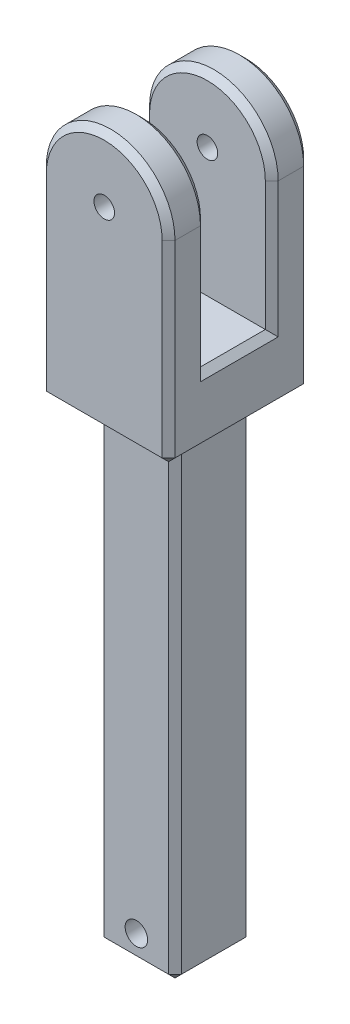
from build123d import *

# Parameters (mm, degrees)
EXTRUDE_1_DEPTH     = 12
CUT_EXTRUDE_1_DEPTH = 39.218600963
CUT_EXTRUDE_6_DEPTH = 39.218600963
SKETCH_12_R         = 1.6
EXTRUDE_11_DEPTH    = 5
EXTRUDE_START       = 5
SKETCH_13_R         = 1.6
EXTRUDE_12_DEPTH    = 5
SKETCH_14_W         = 10.08
SKETCH_14_H         = 30
CUT_EXTRUDE_7_DEPTH = 41.070705753
SKETCH_15_W         = 12
SKETCH_15_H         = 12
EXTRUDE_13_DEPTH    = 74
CUT_EXTRUDE_8_DEPTH = 107.125262104
CHAMFER_1_SIZE      = 1


with BuildPart() as part:
    # 草圖1 → 填料-伸長1 (new body)
    with BuildSketch(Plane.XY):
        with BuildLine():
            ThreePointArc((10, 0), (0, 10), (-10, 0))
            Line((-10, 0), (-10, -30.276417548))
            Line((-10, -30.276417548), (10, -30.276417548))
            Line((10, -30.276417548), (10, 0))
        make_face()
        with BuildLine():
            ThreePointArc((0, -1.6), (-1.13137085, 1.13137085), (1.6, 0))
            ThreePointArc((1.6, 0), (1.13137085, -1.13137085), (0, -1.6))
        make_face(mode=Mode.SUBTRACT)
    extrude(amount=EXTRUDE_1_DEPTH)

    # 草圖2 → 除料-伸長1 (cut, through all)
    with BuildSketch(Plane(origin=(10, 0, 0), x_dir=(0, 0, -1), z_dir=(1, 0, 0))):
        Polygon((-9, 15.780779257), (-9, 0), (-8.60053373, -20), (-3, -20), (-3, 15.780779257), align=None)
    extrude(amount=-CUT_EXTRUDE_1_DEPTH, mode=Mode.SUBTRACT)

    # 草圖11 → 除料-伸長6 (cut, through all)
    with BuildSketch(Plane(origin=(10, 0, 0), x_dir=(0, 0, -1), z_dir=(1, 0, 0))):
        Polygon((-9, 0), (-9, -20), (-8.60053373, -20), align=None)
    extrude(amount=-CUT_EXTRUDE_6_DEPTH, mode=Mode.SUBTRACT)

    # 草圖12 → 填料-伸長11 (add)
    with BuildSketch(Plane.XY.offset(12)):
        with BuildLine():
            Line((10, -30.276417548), (10, 0))
            ThreePointArc((10, 0), (0, 10), (-10, 0))
            Line((-10, 0), (-10, -30.276417548))
            Line((-10, -30.276417548), (10, -30.276417548))
        make_face()
        Circle(SKETCH_12_R, mode=Mode.SUBTRACT)
    extrude(amount=EXTRUDE_11_DEPTH)

    # 草圖13 → 填料-伸長12 (add)
    with BuildSketch(Plane(origin=(0, 0, 0), x_dir=(-1, 0, 0), z_dir=(0, 0, -1)).offset(EXTRUDE_START)):
        with BuildLine():
            Line((10, -30.276417548), (10, 0))
            ThreePointArc((10, 0), (0, 10), (-10, 0))
            Line((-10, 0), (-10, -30.276417548))
            Line((-10, -30.276417548), (10, -30.276417548))
        make_face()
        Circle(SKETCH_13_R, mode=Mode.SUBTRACT)
    extrude(amount=-EXTRUDE_12_DEPTH)

    # 草圖14 → 除料-伸長7 (cut, through all)
    with BuildSketch(Plane.ZY.offset(10)):
        with Locations((6, -5)):
            Rectangle(SKETCH_14_W, SKETCH_14_H)
    extrude(amount=-CUT_EXTRUDE_7_DEPTH, mode=Mode.SUBTRACT)

    # 草圖15 → 填料-伸長13 (add)
    with BuildSketch(Plane.XZ.offset(30.276417548)):
        with Locations((0, 6)):
            Rectangle(SKETCH_15_W, SKETCH_15_H)
    extrude(amount=EXTRUDE_13_DEPTH)

    # 草圖17 → 除料-伸長8 (cut, through all)
    with BuildSketch(Plane(origin=(0, 0, 0), x_dir=(-1, 0, 0), z_dir=(0, 0, -1))):
        with BuildLine():
            ThreePointArc((0, -102.026417548), (1.237436867, -101.513854415), (1.75, -100.276417548))
            ThreePointArc((1.75, -100.276417548), (-1.237436867, -99.038980681), (0, -102.026417548))
        make_face()
    extrude(amount=-CUT_EXTRUDE_8_DEPTH, mode=Mode.SUBTRACT)

    # 導角1
    chamfer_1_edges = [part.edges().sort_by_distance(p)[0] for p in [
        (-10, -10, 0.96),
        (-10, -10, 11.04),
        (-10, -20, 6),
        (0, 10, 0.96),
        (0, 10, 11.04),
        (10, -10, 0.96),
        (10, -10, 11.04),
        (10, -20, 6),
        (0, 10, -5),
        (0, 10, 17),
        (10, -30.276417548, 6),
        (10, -15.138208774, -5),
        (0, -30.276417548, -5),
        (10, -15.138208774, 17),
        (-10, -15.138208774, -5),
        (-10, -30.276417548, 6),
        (-10, -15.138208774, 17),
        (0, -30.276417548, 17),
        (6, -30.276417548, 6),
        (0, -30.276417548, 12),
        (0, -30.276417548, 0),
        (-6, -67.276417548, 12),
        (-6, -104.276417548, 6),
        (-6, -30.276417548, 6),
        (-6, -67.276417548, 0),
        (0, -104.276417548, 0),
        (0, -104.276417548, 12),
        (6, -67.276417548, 12),
        (6, -104.276417548, 6),
        (6, -67.276417548, 0),
    ]]
    chamfer(chamfer_1_edges, length=CHAMFER_1_SIZE)


solid = part.part
